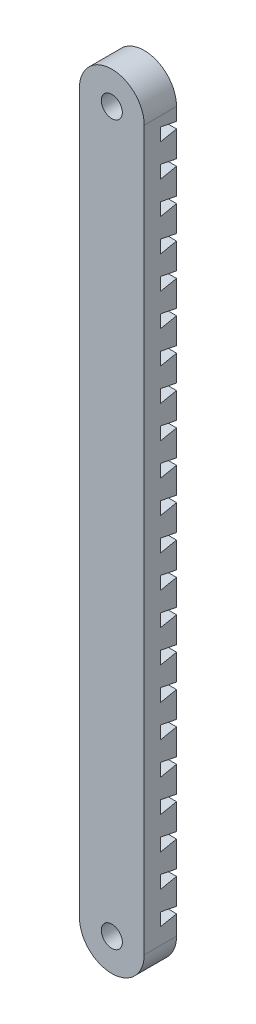
from build123d import *

# Parameters (mm, degrees)
SKETCH1_R           = 1.625
BOSS_EXTRUDE1_DEPTH = 5
CUT_EXTRUDE1_DEPTH  = 117.537547597


with BuildPart() as part:
    # Sketch1 → Boss-Extrude1 (new body)
    with BuildSketch(Plane.XY):
        with BuildLine():
            Line((5, 0), (5, -111))
            ThreePointArc((5, -111), (0, -116), (-5, -111))
            Line((-5, -111), (-5, 0))
            ThreePointArc((-5, 0), (0, 5), (5, 0))
        make_face()
        Circle(SKETCH1_R, mode=Mode.SUBTRACT)
        with Locations((0, -111)):
            Circle(SKETCH1_R, mode=Mode.SUBTRACT)
    extrude(amount=BOSS_EXTRUDE1_DEPTH)

    # Sketch2 → Cut-Extrude1 (cut, through all)
    with BuildSketch(Plane(origin=(5, 0, 0), x_dir=(0, 0, -1), z_dir=(1, 0, 0))):
        Polygon((0, -2), (0, -3), (-2.5, -3.5), (-2.5, -1.5), align=None)
        Polygon((0, -7), (0, -8), (-2.5, -8.5), (-2.5, -6.5), align=None)
        Polygon((0, -12), (0, -13), (-2.5, -13.5), (-2.5, -11.5), align=None)
        Polygon((0, -17), (0, -18), (-2.5, -18.5), (-2.5, -16.5), align=None)
        Polygon((0, -22), (0, -23), (-2.5, -23.5), (-2.5, -21.5), align=None)
        Polygon((0, -27), (0, -28), (-2.5, -28.5), (-2.5, -26.5), align=None)
        Polygon((0, -32), (0, -33), (-2.5, -33.5), (-2.5, -31.5), align=None)
        Polygon((0, -37), (0, -38), (-2.5, -38.5), (-2.5, -36.5), align=None)
        Polygon((0, -42), (0, -43), (-2.5, -43.5), (-2.5, -41.5), align=None)
        Polygon((0, -47), (0, -48), (-2.5, -48.5), (-2.5, -46.5), align=None)
        Polygon((0, -52), (0, -53), (-2.5, -53.5), (-2.5, -51.5), align=None)
        Polygon((0, -57), (0, -58), (-2.5, -58.5), (-2.5, -56.5), align=None)
        Polygon((0, -62), (0, -63), (-2.5, -63.5), (-2.5, -61.5), align=None)
        Polygon((0, -67), (0, -68), (-2.5, -68.5), (-2.5, -66.5), align=None)
        Polygon((0, -72), (0, -73), (-2.5, -73.5), (-2.5, -71.5), align=None)
        Polygon((0, -77), (0, -78), (-2.5, -78.5), (-2.5, -76.5), align=None)
        Polygon((0, -82), (0, -83), (-2.5, -83.5), (-2.5, -81.5), align=None)
        Polygon((0, -87), (0, -88), (-2.5, -88.5), (-2.5, -86.5), align=None)
        Polygon((0, -92), (0, -93), (-2.5, -93.5), (-2.5, -91.5), align=None)
        Polygon((0, -97), (0, -98), (-2.5, -98.5), (-2.5, -96.5), align=None)
        Polygon((0, -102), (0, -103), (-2.5, -103.5), (-2.5, -101.5), align=None)
        Polygon((0, -107), (0, -108), (-2.5, -108.5), (-2.5, -106.5), align=None)
    extrude(amount=-CUT_EXTRUDE1_DEPTH, mode=Mode.SUBTRACT)


solid = part.part
